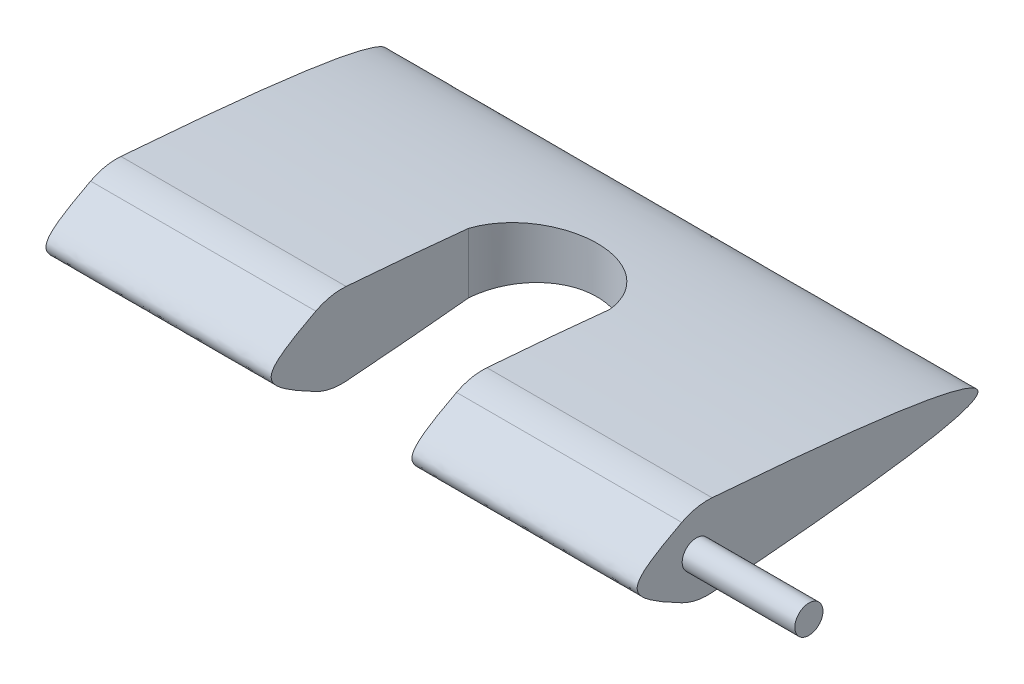
from build123d import *

# Parameters (mm, degrees)
SKETCH1_R               = 1.5
BOSS_EXTRUDE1_DEPTH     = 105
FILLET1_R               = 10
CUT_EXTRUDE1_DEPTH      = 117.542660484
CUT_EXTRUDE1_DEPTH_BACK = 117.542660484
CAVITY1_DEPTH           = 3
SKETCH3_R               = 2.5
SKETCH3_R_2             = 1.5
BOSS_EXTRUDE2_DEPTH     = 20
SKETCH5_R               = 1.5
BOSS_EXTRUDE4_DEPTH     = 37
BOSS_EXTRUDE5_START     = -62
SKETCH5_2_R             = 1.5
BOSS_EXTRUDE5_DEPTH     = 40


# Read off the part's stored shape, not the designer's step: Cavity1
with BuildPart() as part:
    # Sketch1 → Boss-Extrude1 (new body)
    with BuildSketch(Plane(origin=(0, 0, 0), x_dir=(0, 0, -1), z_dir=(1, 0, 0))):
        with BuildLine():
            add(Edge.make_bspline(
                [(3.73e-07, 7.5), (-15, 0), (-3.73e-07, -7.5)],
                knots=[0, 0, 0, 1, 1, 1], degree=2, weights=[1, 2.333333333, 1]))
            add(Edge.make_bspline(
                [(3.73e-07, 7.5), (100, 0), (-3.73e-07, -7.5)],
                knots=[0, 0, 0, 1, 1, 1], degree=2, weights=[1, 1.001467765, 1]))
        make_face()
        Circle(SKETCH1_R, mode=Mode.SUBTRACT)
    extrude(amount=BOSS_EXTRUDE1_DEPTH)

    # Fillet1
    fillet1_edges = [part.edges().sort_by_distance(p)[0] for p in [
        (52.5, -7.5, 3.73e-07),
        (52.5, 7.5, -3.73e-07),
    ]]
    fillet(fillet1_edges, radius=FILLET1_R)

    # Sketch2 → Cut-Extrude1 (cut, two sides: drawn at the far end of the back side and taken through both)
    with BuildSketch(Plane(origin=(0, 0, 0), x_dir=(1, 0, 0), z_dir=(0, 1, 0)).offset(-CUT_EXTRUDE1_DEPTH_BACK)):
        with BuildLine():
            Line((65, 19.76833361), (65, 24.578179161))
            ThreePointArc((65, 24.578179161), (52.5, 34.902500415), (40, 24.578179161))
            Line((40, 24.578179161), (40, 19.76833361))
            Line((40, 19.76833361), (40, 14.958488059))
            ThreePointArc((40, 14.958488059), (52.5, 4.634166805), (65, 14.958488059))
            Line((65, 14.958488059), (65, 19.76833361))
        make_face()
        with BuildLine():
            Line((40, -10.5), (65, -10.5))
            Line((65, -10.5), (65, 14.958488059))
            ThreePointArc((65, 14.958488059), (52.5, 4.634166805), (40, 14.958488059))
            Line((40, 14.958488059), (40, -10.5))
        make_face()
    extrude(amount=CUT_EXTRUDE1_DEPTH + CUT_EXTRUDE1_DEPTH_BACK, mode=Mode.SUBTRACT)

    # Cavity1 outline → Cavity1 (cut)
    with BuildSketch(Plane.YZ):
        with BuildLine():
            ThreePointArc((-2, -13.75), (0, -15.75), (2, -13.75))
            Line((2, -13.75), (2.497863905, -2.796994085))
            ThreePointArc((2.497863905, -2.796994085), (0, 3.75), (-2.497863905, -2.796994085))
            Line((-2.497863905, -2.796994085), (-2, -13.75))
        make_face()
    extrude(amount=CAVITY1_DEPTH, mode=Mode.SUBTRACT)

    # Sketch3 → Boss-Extrude2 (add)
    # profile 1 of 2: a face of its own
    with BuildSketch(Plane(origin=(105, 0, 0), x_dir=(0, 0, -1), z_dir=(1, 0, 0))):
        Circle(SKETCH3_R)
        with Locations(Location((0, 0, 0), (0, 0, 180))):
            Circle(SKETCH3_R_2, mode=Mode.SUBTRACT)
    # profile 2 of 2: a face of its own
    with BuildSketch(Plane(origin=(105, 0, 0), x_dir=(0, 0, -1), z_dir=(1, 0, 0))):
        with Locations(Location((0, 0, 0), (0, 0, 180))):
            Circle(SKETCH3_R_2)
    extrude(amount=BOSS_EXTRUDE2_DEPTH)

    # Sketch5 → Boss-Extrude4 (add)
    with BuildSketch(Plane.ZY.offset(-3)):
        with Locations(Location((0, 0, 0), (0, 0, 180))):
            Circle(SKETCH5_R)
    extrude(amount=-BOSS_EXTRUDE4_DEPTH)

    # Sketch5<2> → Boss-Extrude5 (add)
    with BuildSketch(Plane.ZY.offset(-3).offset(BOSS_EXTRUDE5_START)):
        Circle(SKETCH5_2_R)
    extrude(amount=-BOSS_EXTRUDE5_DEPTH)


solid = part.part
